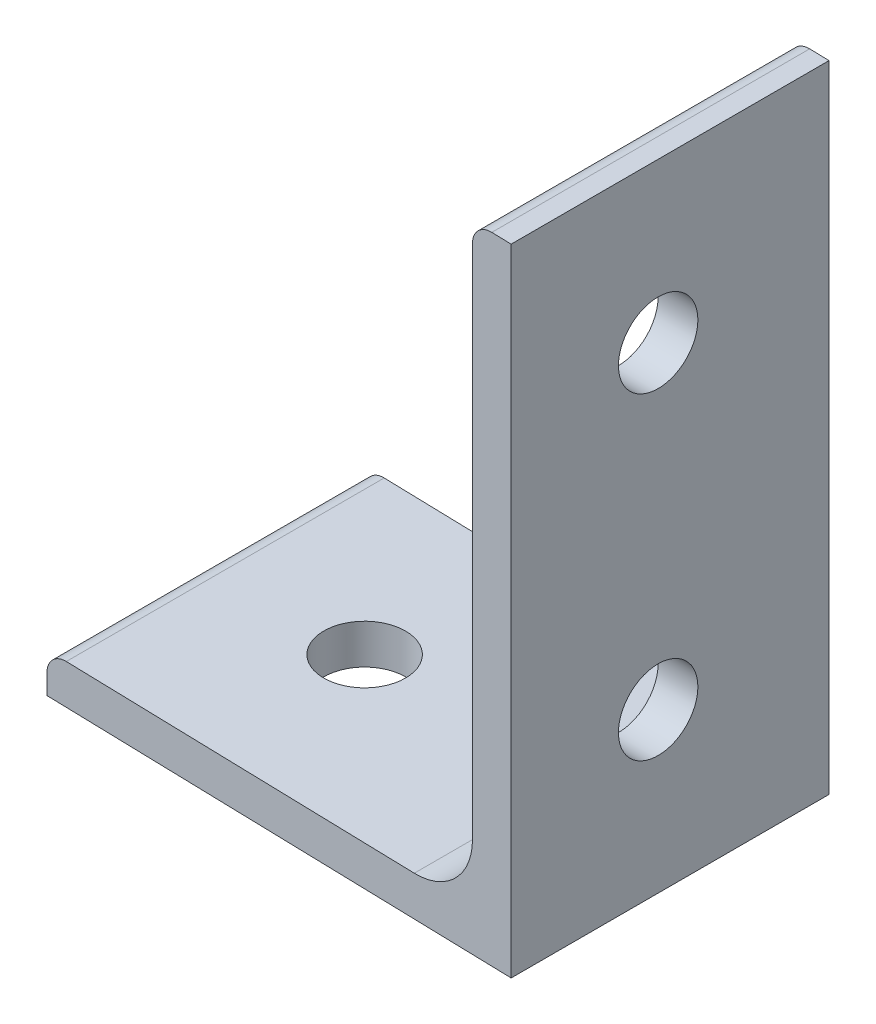
from build123d import *

# Parameters (mm, degrees)
BOSS_EXTRUDE1_DEPTH     = 15.875
SKETCH4_R               = 3.175
CUT_EXTRUDE1_DEPTH      = 49.464271634
SKETCH3_OUTSIDE_W       = 54.3
SKETCH3_OUTSIDE_H       = 47.95
CUT_EXTRUDE2_DEPTH      = 57.529267862
F_1_4_CLEARANCE_HOLE1_D = 6.5278
SKETCH9_R               = 6.35
CUT_EXTRUDE3_DEPTH      = 2.54


with BuildPart() as part:
    # Sketch2 → Boss-Extrude1 (new, symmetric)
    with BuildSketch(Plane.XY):
        with BuildLine():
            Line((-19.05, -25.4), (19.05, -25.4))
            Line((19.05, -25.4), (19.05, 25.4))
            Line((19.05, 25.4), (17.4625, 25.4))
            ThreePointArc((17.4625, 25.4), (16.339967985, 24.935032015), (15.875, 23.8125))
            Line((15.875, 23.8125), (15.875, -17.4498))
            ThreePointArc((15.875, -17.4498), (14.476376302, -20.826376302), (11.0998, -22.225))
            Line((11.0998, -22.225), (-17.4625, -22.225))
            ThreePointArc((-17.4625, -22.225), (-18.585032015, -22.689967985), (-19.05, -23.8125))
            Line((-19.05, -23.8125), (-19.05, -25.4))
        make_face()
    extrude(amount=BOSS_EXTRUDE1_DEPTH, both=True)

    # Sketch4 → Cut-Extrude1 (cut, through all)
    with BuildSketch(Plane(origin=(19.05, 0, 0), x_dir=(0, 0, -1), z_dir=(1, 0, 0))):
        with Locations((-3.175, 12.7)):
            Circle(SKETCH4_R)
        with Locations((-3.175, -12.7)):
            Circle(SKETCH4_R)
    extrude(amount=-CUT_EXTRUDE1_DEPTH, mode=Mode.SUBTRACT)

    # Sketch3 outside → Cut-Extrude2 (cut, through all)
    with BuildSketch(Plane.XZ.offset(25.4)):
        Rectangle(SKETCH3_OUTSIDE_W, SKETCH3_OUTSIDE_H)
        Polygon((-19.05, 13.926834826), (-19.05, -11.481872103), (19.05, -10.484188491), (19.05, 14.924518438), align=None, mode=Mode.SUBTRACT)
    extrude(amount=-CUT_EXTRUDE2_DEPTH, mode=Mode.SUBTRACT)

    # 1/4 Clearance Hole1 (through all)
    with Locations(Plane(origin=(0, -25.4, 0), x_dir=(-1, 0, 0), z_dir=(0, -1, 0))):
        with Locations((6.021904729, -1.56363455)):
            Hole(F_1_4_CLEARANCE_HOLE1_D / 2)

    # Sketch9 → Cut-Extrude3 (cut)
    with BuildSketch(Plane.ZY.offset(-15.875)):
        with Locations((3.175, -12.7)):
            Circle(SKETCH9_R)
    extrude(amount=CUT_EXTRUDE3_DEPTH, mode=Mode.SUBTRACT)


solid = part.part
